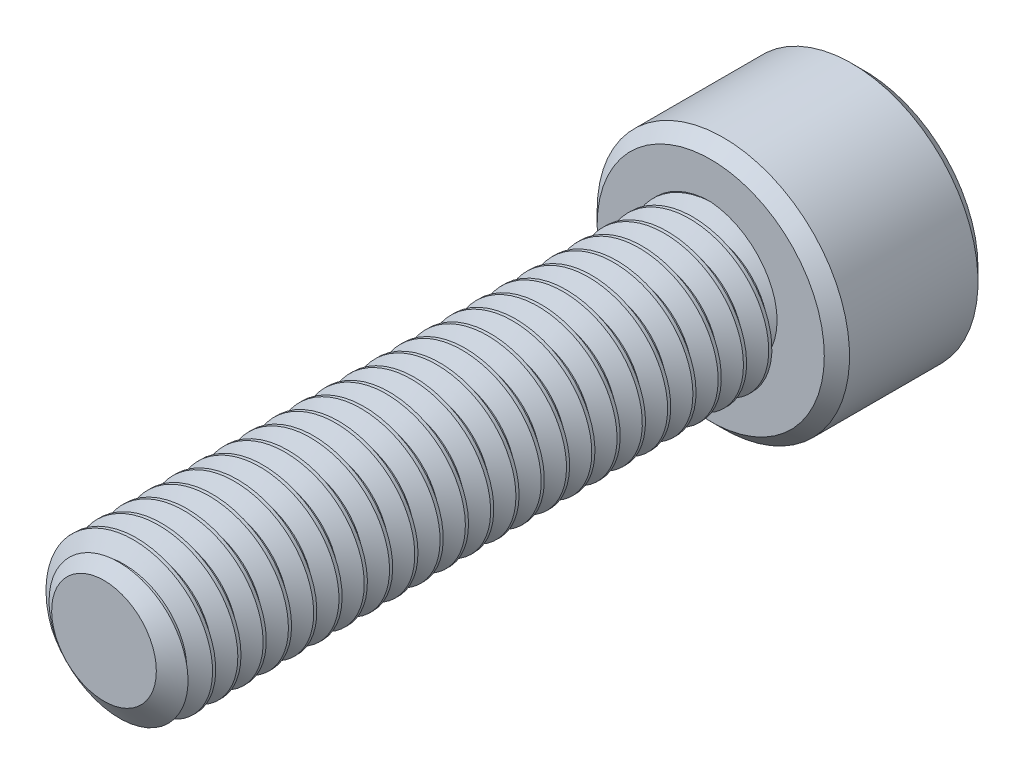
from build123d import *

# Parameters (mm, degrees)
SKETCH1_R          = 2.413
EXTRUDE1_DEPTH     = 19.05
CUT_SWEEP1_PITCH   = 0.79375
SKETCH6_R          = 3.9624
EXTRUDE2_DEPTH     = 4.826
CUT_EXTRUDE1_DEPTH = 2.9765625
CHAMFER1_SIZE      = 0.39624


with BuildPart() as part:
    # Sketch1 → Extrude1 (new body)
    with BuildSketch(Plane.XY):
        Circle(SKETCH1_R)
    extrude(amount=-EXTRUDE1_DEPTH)

    # Cut-Sweep1: the profile of Sketch3 profile screwed along a right-hand helix of 25 turns, 6 arcs to a turn; built about Z, then put on its axis
    cut_sweep1_z = Axis((0, 0, 0), (0, 0, 1))
    cut_sweep1_corners = [(2.4133, 0, -0.694704455), (1.897444252, 0, -0.396875), (1.897444252, 0, -0.29765625), (2.4133, 0, 0.000173205)]
    with BuildLine(mode=Mode.PRIVATE) as cut_sweep1_profile:
        Line(cut_sweep1_corners[0], cut_sweep1_corners[1])
        Line(cut_sweep1_corners[1], cut_sweep1_corners[2])
        Line(cut_sweep1_corners[2], cut_sweep1_corners[3])
        Line(cut_sweep1_corners[3], cut_sweep1_corners[0])
    cut_sweep1_cap = Face(cut_sweep1_profile.wire())
    cut_sweep1_turn_angles = [0, 30, 60, 90, 120, 150, 180, 210, 240, 270, 300, 330, 360]
    cut_sweep1_turn_weights = [1, 0.8660254037844387, 1, 0.8660254037844387, 1, 0.8660254037844387, 1, 0.8660254037844387, 1, 0.8660254037844387, 1, 0.8660254037844387, 1]
    cut_sweep1_turn_rails = [Edge.make_bspline([Vector(p[0], p[1], 0).rotate(cut_sweep1_z, cut_sweep1_turn_angles[k]) / cut_sweep1_turn_weights[k] + Vector(0, 0, p[2] + CUT_SWEEP1_PITCH * cut_sweep1_turn_angles[k] / 360) for k in range(13)], [0, 0, 0, 1, 1, 2, 2, 3, 3, 4, 4, 5, 5, 6, 6, 6], 2, cut_sweep1_turn_weights) for p in cut_sweep1_corners]
    cut_sweep1_turn_sides = [Face.make_surface_from_curves(cut_sweep1_turn_rails[p[0]], cut_sweep1_turn_rails[p[1]]) for p in [(0, 1), (1, 2), (2, 3), (3, 0)]]
    cut_sweep1 = Plane(origin=(0, 0, 0), x_dir=(0, 1, 0), z_dir=(0, 0, -1)) * Solid(Shell([*[p.moved(Location((0, 0, CUT_SWEEP1_PITCH * i))) for i in range(25) for p in cut_sweep1_turn_sides], cut_sweep1_cap, cut_sweep1_cap.rotate(cut_sweep1_z, 9000).moved(Location((0, 0, CUT_SWEEP1_PITCH * 9000 / 360)))]))
    add(cut_sweep1, mode=Mode.SUBTRACT)

    # Sketch4 → Cut-Revolve1 (revolve, cut)
    with BuildSketch(Plane(origin=(0, 0, 0), x_dir=(0, 0, -1), z_dir=(1, 0, 0)), mode=Mode.PRIVATE) as cut_revolve1_sk:
        Polygon((0.538848736, 2.413), (0, 1.643444252), (0, 2.413), align=None)
    revolve(cut_revolve1_sk.sketch.rotate(Axis((0, 0, 0), (0, 0, -1)), 261.048315518), axis=Axis((0, 0, 0), (0, 0, -1)), mode=Mode.SUBTRACT)

    # Sketch6 → Extrude2 (add)
    with BuildSketch(Plane(origin=(0, 0, -19.05), x_dir=(-1, 0, 0), z_dir=(0, 0, -1))):
        Circle(SKETCH6_R)
    extrude(amount=EXTRUDE2_DEPTH)

    # Sketch7 → Cut-Extrude1 (cut)
    with BuildSketch(Plane(origin=(0, 0, -23.876), x_dir=(-1, 0, 0), z_dir=(0, 0, -1))):
        Polygon((0, 2.291358881), (-1.984375, 1.14567944), (-1.984375, -1.14567944), (0, -2.291358881), (1.984375, -1.14567944), (1.984375, 1.14567944), align=None)
    extrude(amount=-CUT_EXTRUDE1_DEPTH, mode=Mode.SUBTRACT)

    # Cut-Extrude2 cone 1 section (through the dimple's axis) → Cut-Extrude2 (revolve, cut)
    with BuildSketch(Plane(origin=(0, 0, -23.876), x_dir=(0, 1, 0), z_dir=(1, 0, 0))):
        Polygon((0, 0), (2.291358881, 0), (0, 2.291358881), align=None)
    revolve(axis=Axis((0, 0, -23.876), (0, 0, 1)), mode=Mode.SUBTRACT)

    # Chamfer1
    chamfer1_edges = [part.edges().sort_by_distance(p)[0] for p in [
        (3.9624, 0, -19.05),
        (3.9624, 0, -23.876),
    ]]
    chamfer(chamfer1_edges, length=CHAMFER1_SIZE)


solid = part.part
